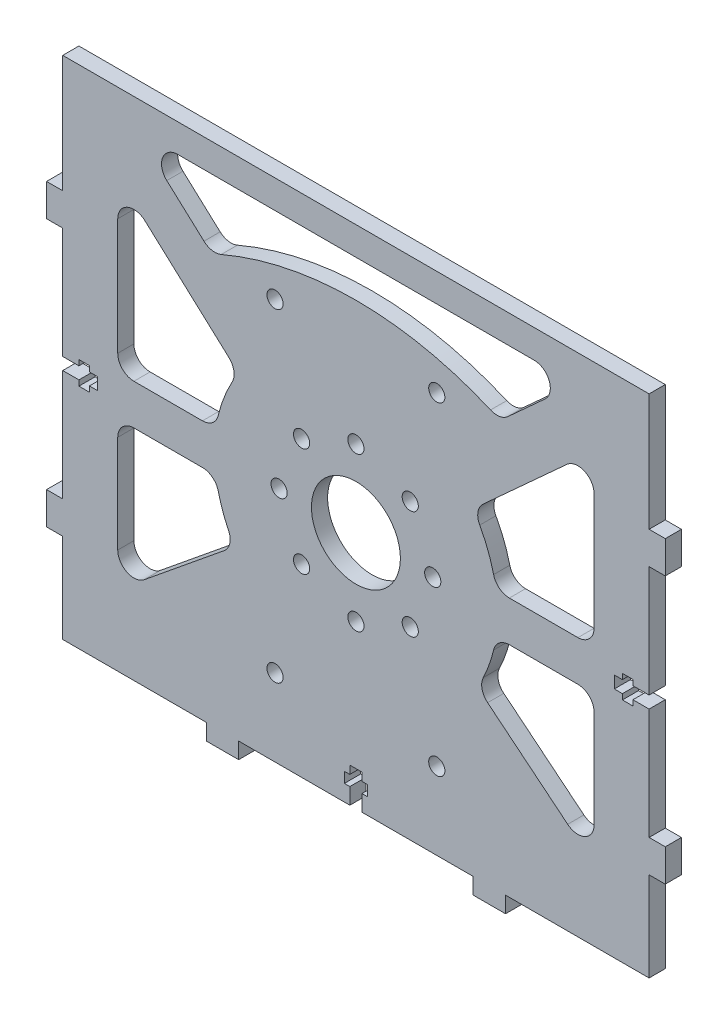
from build123d import *

# Parameters (mm, degrees)
SKETCH_1_R          = 2
SKETCH_1_R_2        = 11
EXTRUDE_1_DEPTH     = 4
CUT_EXTRUDE_2_DEPTH = 4


with BuildPart() as part:
    # 草图1 → 凸台-拉伸1 (new body)
    with BuildSketch(Plane.XY):
        Polygon((145, 64.5), (149, 64.5), (149, 63.15), (151.6, 63.15), (151.6, 64.5), (153.6, 64.5), (153.6, 67.5), (151.6, 67.5), (151.6, 68.85), (149, 68.85), (149, 67.5), (145, 67.5), (145, 95), (141, 95), (141, 103), (145, 103), (145, 132), (290, 132), (290, 103), (294, 103), (294, 95), (290, 95), (290, 67.5), (286, 67.5), (286, 68.85), (283.4, 68.85), (283.4, 67.5), (281.4, 67.5), (281.4, 64.5), (283.4, 64.5), (283.4, 63.15), (286, 63.15), (286, 64.5), (290, 64.5), (290, 37), (294, 37), (294, 29), (290, 29), (290, 6.9), (283.5, 6.9), (254.5, 6.9), (254.5, 2.9), (246.5, 2.9), (246.5, 6.9), (219, 6.9), (219, 10.9), (220.35, 10.9), (220.35, 13.5), (219, 13.5), (219, 15.5), (216, 15.5), (216, 13.5), (214.65, 13.5), (214.65, 10.9), (216, 10.9), (216, 6.9), (188.5, 6.9), (188.5, 2.9), (180.5, 2.9), (180.5, 6.9), (151.5, 6.9), (145, 6.9), (145, 29), (141, 29), (141, 37), (145, 37), align=None)
        with Locations((217.5, 47)):
            Circle(SKETCH_1_R, mode=Mode.SUBTRACT)
        with Locations((204.064971157, 52.564971157)):
            Circle(SKETCH_1_R, mode=Mode.SUBTRACT)
        with Locations((198.5, 66)):
            Circle(SKETCH_1_R, mode=Mode.SUBTRACT)
        with Locations((204.064971157, 79.435028843)):
            Circle(SKETCH_1_R, mode=Mode.SUBTRACT)
        with Locations((217.5, 85)):
            Circle(SKETCH_1_R, mode=Mode.SUBTRACT)
        with Locations((230.935028843, 79.435028843)):
            Circle(SKETCH_1_R, mode=Mode.SUBTRACT)
        with Locations((236.5, 66)):
            Circle(SKETCH_1_R, mode=Mode.SUBTRACT)
        with Locations((230.935028843, 52.564971157)):
            Circle(SKETCH_1_R, mode=Mode.SUBTRACT)
        with Locations((217.5, 66)):
            Circle(SKETCH_1_R_2, mode=Mode.SUBTRACT)
        with Locations((197.5, 106)):
            Circle(SKETCH_1_R, mode=Mode.SUBTRACT)
        with Locations((237.5, 106)):
            Circle(SKETCH_1_R, mode=Mode.SUBTRACT)
        with Locations((237.5, 26)):
            Circle(SKETCH_1_R, mode=Mode.SUBTRACT)
        with Locations((197.5, 26)):
            Circle(SKETCH_1_R, mode=Mode.SUBTRACT)
    extrude(amount=EXTRUDE_1_DEPTH)

    # 草图3 → 切除-拉伸2 (cut)
    with BuildSketch(Plane(origin=(0, 0, 0), x_dir=(-1, 0, 0), z_dir=(0, 0, -1))):
        with BuildLine():
            Line((-255.447331922, 61), (-272.4, 61))
            ThreePointArc((-272.4, 61), (-275.228427125, 59.828427125), (-276.4, 57))
            Line((-276.4, 57), (-276.4, 32.858450899))
            ThreePointArc((-276.4, 32.858450899), (-274.116182938, 29.24531983), (-269.872641938, 29.758053953))
            Line((-269.872641938, 29.758053953), (-250.07214558, 45.898872363))
            ThreePointArc((-250.07214558, 45.898872363), (-248.6940963, 48.134518776), (-248.999554551, 50.742933995))
            ThreePointArc((-248.999554551, 50.742933995), (-250.473448142, 54.263232234), (-251.555297879, 57.923076923))
            ThreePointArc((-251.555297879, 57.923076923), (-252.96663723, 60.137858162), (-255.447331922, 61))
        make_face()
        with BuildLine():
            Line((-269.707278747, 106.765103218), (-248.927132883, 87.848004914))
            ThreePointArc((-248.927132883, 87.848004914), (-247.673089718, 85.54051484), (-248.120381917, 82.952646144))
            ThreePointArc((-248.120381917, 82.952646144), (-250.140932956, 78.632082004), (-251.555297879, 74.076923077))
            ThreePointArc((-251.555297879, 74.076923077), (-252.96663723, 71.862141838), (-255.447331922, 71))
            Line((-255.447331922, 71), (-272.4, 71))
            ThreePointArc((-272.4, 71), (-275.228427125, 72.171572875), (-276.4, 75))
            Line((-276.4, 75), (-276.4, 103.807189721))
            ThreePointArc((-276.4, 103.807189721), (-274.016959336, 107.465801822), (-269.707278747, 106.765103218))
        make_face()
        with BuildLine():
            Line((-158.6, 57), (-158.6, 32.858450899))
            ThreePointArc((-158.6, 32.858450899), (-160.883817062, 29.24531983), (-165.127358062, 29.758053953))
            Line((-165.127358062, 29.758053953), (-184.92785442, 45.898872363))
            ThreePointArc((-184.92785442, 45.898872363), (-186.3059037, 48.134518776), (-186.000445449, 50.742933995))
            ThreePointArc((-186.000445449, 50.742933995), (-184.526551858, 54.263232234), (-183.444702121, 57.923076923))
            ThreePointArc((-183.444702121, 57.923076923), (-182.03336277, 60.137858162), (-179.552668078, 61))
            Line((-179.552668078, 61), (-162.6, 61))
            ThreePointArc((-162.6, 61), (-159.771572875, 59.828427125), (-158.6, 57))
        make_face()
        with BuildLine():
            Line((-179.552668078, 71), (-162.6, 71))
            ThreePointArc((-162.6, 71), (-159.771572875, 72.171572875), (-158.6, 75))
            Line((-158.6, 75), (-158.6, 103.807189721))
            ThreePointArc((-158.6, 103.807189721), (-160.983040664, 107.465801822), (-165.292721253, 106.765103218))
            Line((-165.292721253, 106.765103218), (-186.072867117, 87.848004914))
            ThreePointArc((-186.072867117, 87.848004914), (-187.326910282, 85.54051484), (-186.879618083, 82.952646144))
            ThreePointArc((-186.879618083, 82.952646144), (-184.859067044, 78.632082004), (-183.444702121, 74.076923077))
            ThreePointArc((-183.444702121, 74.076923077), (-182.03336277, 71.862141838), (-179.552668078, 71))
        make_face()
        with BuildLine():
            Line((-261.576319533, 125), (-173.423680467, 125))
            ThreePointArc((-173.423680467, 125), (-169.693288129, 122.443666515), (-170.730959214, 118.042086503))
            Line((-170.730959214, 118.042086503), (-179.92985273, 109.667921372))
            ThreePointArc((-179.92985273, 109.667921372), (-181.961826365, 108.680785745), (-184.204551796, 108.951961409))
            ThreePointArc((-184.204551796, 108.951961409), (-217.5, 115.815856239), (-250.795448204, 108.951961409))
            ThreePointArc((-250.795448204, 108.951961409), (-253.038173635, 108.680785745), (-255.07014727, 109.667921372))
            Line((-255.07014727, 109.667921372), (-264.269040786, 118.042086503))
            ThreePointArc((-264.269040786, 118.042086503), (-265.306711871, 122.443666515), (-261.576319533, 125))
        make_face()
    extrude(amount=-CUT_EXTRUDE_2_DEPTH, mode=Mode.SUBTRACT)


solid = part.part
